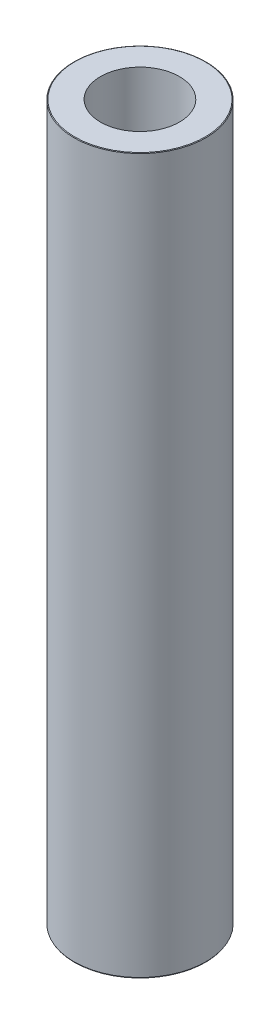
from build123d import *
from OCP.BRepFilletAPI import BRepFilletAPI_MakeChamfer

# Parameters (mm, degrees)
SKETCH1_R           = 40
BOSS_EXTRUDE1_DEPTH = 433.719628148
SKETCH2_R           = 23.978313602
CUT_EXTRUDE1_DEPTH  = 438.393090755
CHAMFER1_SIZE       = 0.256084258
CHAMFER1_SIZE2      = 0.443550945


with BuildPart() as part:
    # Sketch1 → Boss-Extrude1 (new body)
    with BuildSketch(Plane(origin=(0, 0, 0), x_dir=(1, 0, 0), z_dir=(0, 1, 0))):
        Circle(SKETCH1_R)
    extrude(amount=BOSS_EXTRUDE1_DEPTH)

    # Sketch2 → Cut-Extrude1 (cut, through all)
    with BuildSketch(Plane(origin=(0, 0, 0), x_dir=(1, 0, 0), z_dir=(0, 1, 0))):
        Circle(SKETCH2_R)
    extrude(amount=CUT_EXTRUDE1_DEPTH, mode=Mode.SUBTRACT)

    # Chamfer1: one chamfer whose edges measure the first distance from different faces: ONE call of the kernel's chamfer builder (chamfer() names one face for all edges)
    chamfer1_edges_1 = [part.edges().sort_by_distance(p)[0] for p in [
        (-40, 433.719628148, 0),
    ]]
    chamfer1_side_1 = [part.faces().sort_by_distance(p)[0] for p in [
        (-40, 216.859814074, 0),
    ]]
    chamfer1_edges_2 = [part.edges().sort_by_distance(p)[0] for p in [
        (-40, 0, 0),
    ]]
    chamfer1_side_2 = [part.faces().sort_by_distance(p)[0] for p in [
        (-38.86862915, 0, 0),
    ]]
    chamfer1 = BRepFilletAPI_MakeChamfer(part.part.solid().wrapped)
    for e in chamfer1_edges_1:
        chamfer1.Add(CHAMFER1_SIZE, CHAMFER1_SIZE2, e.wrapped, chamfer1_side_1[0].wrapped)  # the first distance lies on this face
    for e in chamfer1_edges_2:
        chamfer1.Add(CHAMFER1_SIZE, CHAMFER1_SIZE2, e.wrapped, chamfer1_side_2[0].wrapped)  # the first distance lies on this face
    add(Compound.cast(chamfer1.Shape()), mode=Mode.REPLACE)


solid = part.part
